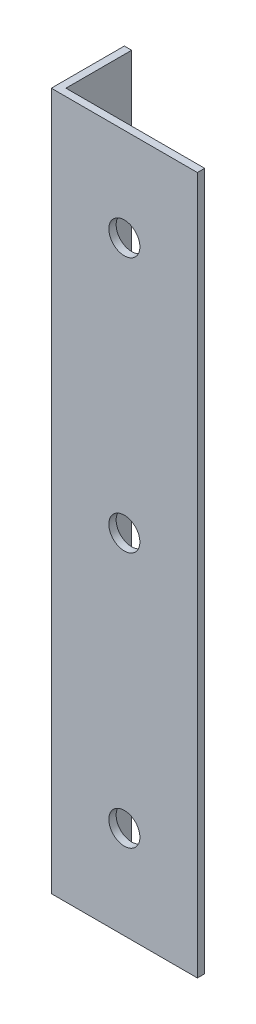
from build123d import *

# Parameters (mm, degrees)
EXTRUDE_1_DEPTH     = 191
SKETCH_2_R          = 4.25
CUT_EXTRUDE_1_DEPTH = 197.165746245


with BuildPart() as part:
    # Эскиз1 → Бобышка-Вытянуть1 (new body)
    with BuildSketch(Plane(origin=(0, 0, 0), x_dir=(1, 0, 0), z_dir=(0, 1, 0))):
        Polygon((0, 0), (0, 20), (2, 20), (2, 2), (40, 2), (40, 0), align=None)
    extrude(amount=EXTRUDE_1_DEPTH)

    # Эскиз2 → Вырез-Вытянуть1 (cut, through all)
    with BuildSketch(Plane.XY):
        with Locations((20, 165.5)):
            Circle(SKETCH_2_R)
        with Locations((20, 95.5)):
            Circle(SKETCH_2_R)
        with Locations((20, 25.5)):
            Circle(SKETCH_2_R)
    extrude(amount=-CUT_EXTRUDE_1_DEPTH, mode=Mode.SUBTRACT)


solid = part.part
